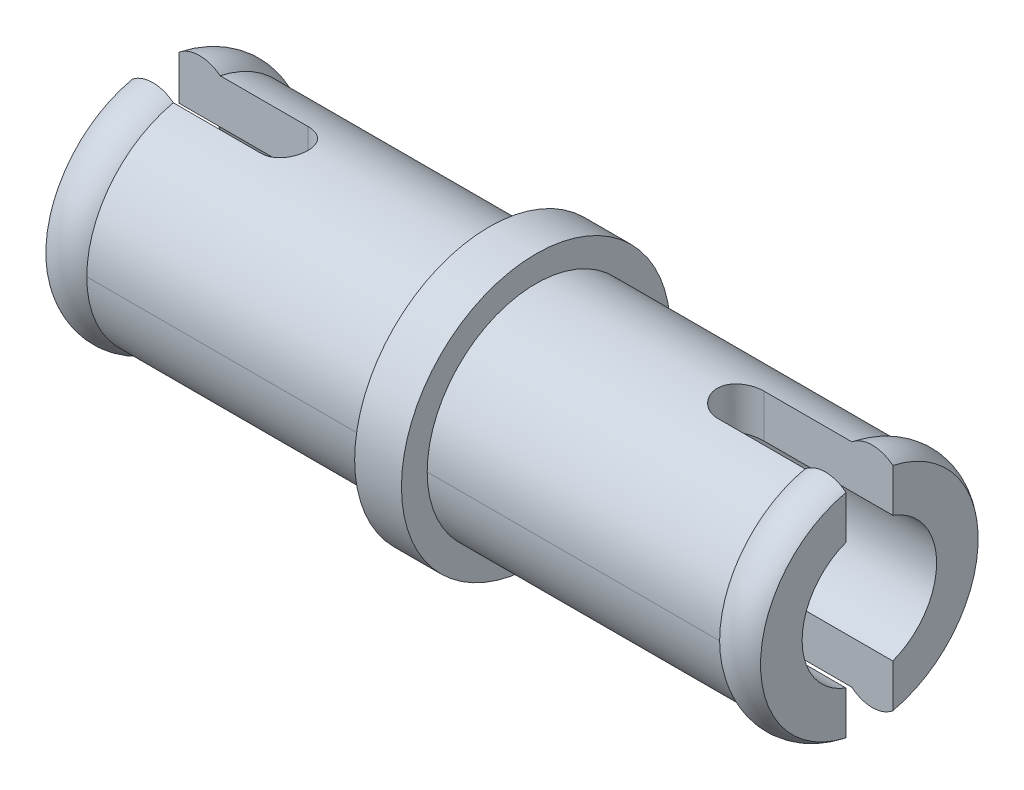
from build123d import *

# Parameters (mm, degrees)
SKETCH1_R           = 2.3622
BASE_EXTRUDE_DEPTH  = 7.239
SKETCH3_R           = 2.921
BOSS_EXTRUDE1_DEPTH = 1.016
SKETCH4_R           = 2.3876
BOSS_EXTRUDE2_DEPTH = 7.239
SKETCH7_R           = 1.4605
CUT_EXTRUDE2_DEPTH  = 17.035227504
CUT_EXTRUDE4_DEPTH  = 10.230899667


with BuildPart() as part:
    # Sketch1 → Base-Extrude (new body)
    with BuildSketch(Plane(origin=(0, 0, 0), x_dir=(0, 0, -1), z_dir=(1, 0, 0))):
        Circle(SKETCH1_R)
    extrude(amount=BASE_EXTRUDE_DEPTH)

    # Sketch3 → Boss-Extrude1 (add)
    with BuildSketch(Plane.ZY):
        Circle(SKETCH3_R)
    extrude(amount=BOSS_EXTRUDE1_DEPTH)

    # Sketch4 → Boss-Extrude2 (add)
    with BuildSketch(Plane.ZY.offset(1.016)):
        Circle(SKETCH4_R)
    extrude(amount=BOSS_EXTRUDE2_DEPTH)

    # Sketch6 → Boss-Revolve2 (revolve)
    with BuildSketch(Plane(origin=(0, 0, 0), x_dir=(1, 0, 0), z_dir=(0, 1, 0))):
        with BuildLine():
            Line((-8.255, 2.3876), (-7.366, 2.3876))
            ThreePointArc((-7.366, 2.3876), (-7.8105, 2.54), (-8.255, 2.3876))
        make_face()
    revolve(axis=Axis((0, 0, 0), (-1, 0, 0)))

    # Sketch9 → Boss-Revolve3 (revolve)
    with BuildSketch(Plane(origin=(0, 0, 0), x_dir=(1, 0, 0), z_dir=(0, 1, 0))):
        with BuildLine():
            Line((6.35, 2.3622), (7.239, 2.3622))
            ThreePointArc((7.239, 2.3622), (6.7945, 2.520115861), (6.35, 2.3622))
        make_face()
    revolve(axis=Axis((0, 0, 0), (1, 0, 0)))

    # Sketch7 → Cut-Extrude2 (cut, through all)
    with BuildSketch(Plane.ZY.offset(8.255)):
        Circle(SKETCH7_R)
    extrude(amount=-CUT_EXTRUDE2_DEPTH, mode=Mode.SUBTRACT)

    # Sketch8 → Cut-Extrude4 (cut, symmetric)
    with BuildSketch(Plane(origin=(0, 0, 0), x_dir=(1, 0, 0), z_dir=(0, 1, 0))):
        with BuildLine():
            Line((-8.255, 0.508), (-5.461, 0.508))
            ThreePointArc((-5.461, 0.508), (-4.953, 0), (-5.461, -0.508))
            Line((-5.461, -0.508), (-8.255, -0.508))
            Line((-8.255, -0.508), (-8.255, 0.508))
        make_face()
    cut_extrude4 = extrude(amount=CUT_EXTRUDE4_DEPTH, both=True, mode=Mode.SUBTRACT)

    # Mirror7: Cut-Extrude4 across plane
    add(cut_extrude4.mirror(Plane(origin=(-0.508, 0, 0), x_dir=(0, 0, 1), z_dir=(1, 0, 0))), mode=Mode.SUBTRACT)


solid = part.part
